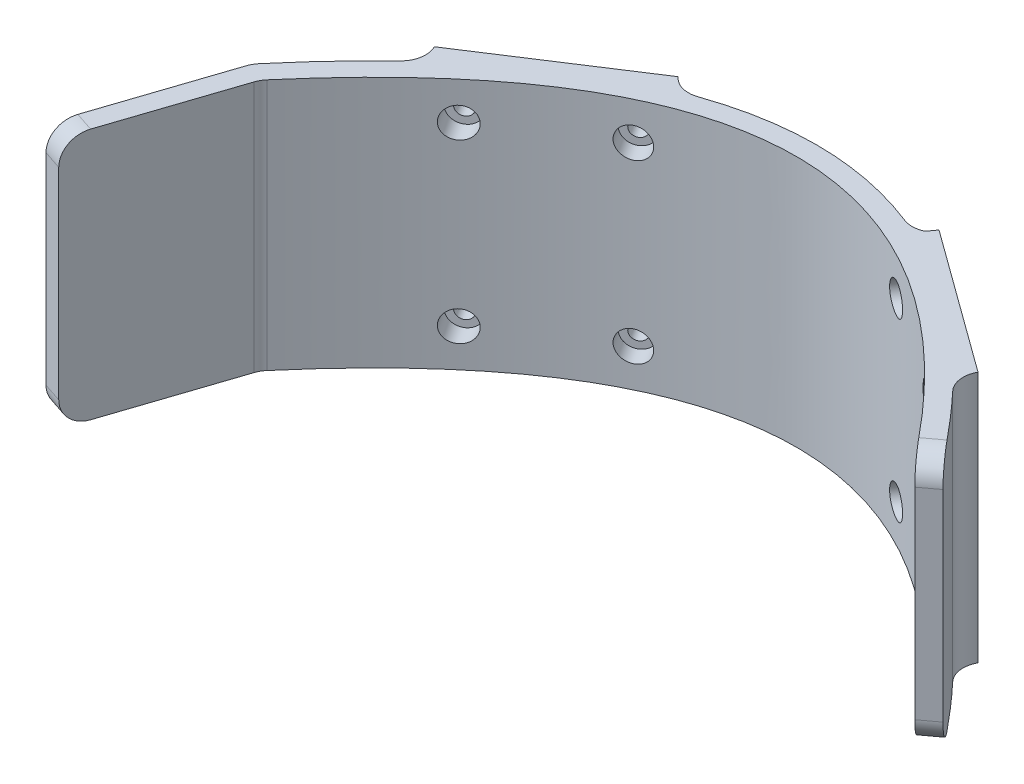
from build123d import *

# Parameters (mm, degrees)
EXTRUDE_518_DEPTH   = 50
EXTRUDE_3_DEPTH     = 50
SKETCH_7_W          = 35
SKETCH_7_H          = 50
EXTRUDE_4_DEPTH     = 2
SKETCH_9_W          = 35
SKETCH_9_H          = 50
EXTRUDE_7_DEPTH     = 2
CUT_EXTRUDE_1_REACH = 186.588
SKETCH_5_R          = 1.65
CUT_EXTRUDE_2_REACH = 190.231
SKETCH_6_R          = 1.6
CUT_EXTRUDE_3_REACH = 189.588
CUT_EXTRUDE_START   = -3
SKETCH_10_R         = 3
CUT_EXTRUDE_4_REACH = 193.231
SKETCH_11_R         = 3
FILLET_START        = 69.07929813
FILLET_1_DEPTH      = 15.92070187
CUT_EXTRUDE_5_DEPTH = 140.842769019
FILLET_5_DEPTH      = 50
FILLET_START_2      = -82.248874185
FILLET_5_2_DEPTH    = 136.130704959
FILLET_START_3      = -71
FILLET_5_3_DEPTH    = 127.377557029
FILLET_5_4_DEPTH    = 50


with BuildPart() as part:
    # 草图1 → Extrude 518 (new body)
    with BuildSketch(Plane(origin=(0, 0, 0), x_dir=(1, 0, 0), z_dir=(0, 1, 0))):
        with BuildLine():
            Line((-83.794733192, -28.735088936), (-80, -30))
            Line((-80, -30), (-70, 0))
            add(Edge.make_bspline(
                [(-70, 0), (-2.236067977, 80.249223595), (60, 0)],
                knots=[0, 0, 0, 1, 1, 1], degree=2))
            add(Edge.make_bspline(
                [(60, 0), (72.314757303, -17.257937134), (80, -98.057134848), (80, -100)],
                knots=[0, 0, 0, 0, 1, 1, 1, 1], degree=3))
            Line((80, -100), (84, -100))
            add(Edge.make_bspline(
                [(84, -100), (84, -99.959886958), (83.998702187, -99.871585847), (83.994846201, -99.759654237), (83.986240115, -99.582476755), (83.962303503, -99.218374034), (83.90343119, -98.472822794), (83.789938955, -97.185208658), (83.581341809, -94.964093759), (83.213758816, -91.29768522), (82.605428893, -85.674062283), (81.834044785, -79.033271633), (80.59373324, -69.099294797), (78.656649569, -55.17705216), (76.230522446, -40.630293547), (74.008089015, -29.437176625), (72.201399356, -21.464643086), (70.252439441, -14.108934539), (68.502001513, -8.646071143), (67.00891604, -4.753669274), (65.833049197, -2.088339118), (64.790849947, -0.085322931), (64.016619658, 1.196481072), (63.6114109, 1.812503646), (63.409013675, 2.106949825), (63.284920778, 2.283139903), (63.235887133, 2.351645721), (63.2097134, 2.388325667)],
                knots=[-0.001253817, -0.001253817, -0.001253817, -0.001253817, 0.002657331, 0.006568479, 0.014390774, 0.030035365, 0.061324547, 0.092613729, 0.123902911, 0.186481274, 0.249059638, 0.311638001, 0.374216365, 0.499373092, 0.624529819, 0.687108182, 0.749686546, 0.812264909, 0.874843273, 0.906132455, 0.937421636, 0.968710818, 0.984355409, 0.992177705, 0.996088852, 0.998044426, 1, 1, 1, 1], degree=3))
            add(Edge.make_bspline(
                [(63.2097134, 2.388325667), (51.280212928, 17.811719498), (30.651240773, 34.166498062), (13.639046127, 42.149170793), (-3.828626529, 44.805457924), (-21.438149711, 42.011295445), (-38.916699142, 33.929127749), (-54.089923665, 22.410216664), (-63.824057794, 12.896858749), (-68.69180734, 7.613741584), (-71.125356785, 4.842073359), (-72.750666275, 2.946716639), (-73.551797384, 1.993718489)],
                knots=[-0.003657098, -0.003657098, -0.003657098, 0.184602227, 0.310108443, 0.435614659, 0.561120876, 0.686627092, 0.812133309, 0.906262971, 0.953327802, 0.976860218, 0.988626425, 1.000392633, 1.000392633, 1.000392633], degree=2))
            Line((-73.551797384, 1.993718489), (-83.794733192, -28.735088936))
        make_face()
    extrude(amount=EXTRUDE_518_DEPTH)

    # 草图4 → 凸台-拉伸3 (add)
    with BuildSketch(Plane(origin=(0, 50, 0), x_dir=(1, 0, 0), z_dir=(0, 1, 0))):
        with BuildLine():
            add(Edge.make_bspline(
                [(-27.24320272, 39.251737644), (-28.711235197, 38.648184747), (-35.700638547, 35.416250073), (-41.196348124, 31.847294586)],
                knots=[0.665570898, 0.665570898, 0.665570898, 0.686627092, 0.765946913, 0.765946913, 0.765946913], degree=2))
            Line((-27.24320272, 39.251737644), (-28, 40.41710326))
            Line((-28, 40.41710326), (-41.196348124, 31.847294586))
        make_face()
        with BuildLine():
            add(Edge.make_bspline(
                [(-41.196348124, 31.847294586), (-44.396393357, 29.769160937), (-52.020982982, 23.980874484), (-56.448628782, 19.961403933)],
                knots=[0.765946913, 0.765946913, 0.765946913, 0.812133309, 0.876314584, 0.876314584, 0.876314584], degree=2))
            Line((-41.196348124, 31.847294586), (-57.353469878, 21.354737034))
            Line((-57.353469878, 21.354737034), (-56.448628782, 19.961403933))
        make_face()
        with BuildLine():
            Line((35.593931445, 30.137934955), (22, 40.014504272))
            Line((22, 40.014504272), (21.328658958, 38.534582951))
            add(Edge.make_bspline(
                [(35.593931445, 30.137934955), (28.951003671, 34.964304379), (21.737163158, 38.349271995), (21.328658958, 38.534582951)],
                knots=[0.209688975, 0.209688975, 0.209688975, 0.310108443, 0.316128132, 0.316128132, 0.316128132], degree=2))
        make_face()
        with BuildLine():
            Line((50.315594803, 19.442020442), (35.593931445, 30.137934955))
            add(Edge.make_bspline(
                [(49.413058713, 18.199786086), (44.198944904, 23.42579322), (37.253464832, 28.932213401), (35.593931445, 30.137934955)],
                knots=[0.104048602, 0.104048602, 0.104048602, 0.184602227, 0.209688975, 0.209688975, 0.209688975], degree=2))
            Line((49.413058713, 18.199786086), (50.315594803, 19.442020442))
        make_face()
    extrude(amount=-EXTRUDE_3_DEPTH)

    # 草图7 → 凸台-拉伸4 (add)
    with BuildSketch(Plane(origin=(26.628840579, 0, -36.651454736), x_dir=(-0.8090169943749487, 0, -0.5877852522924714), z_dir=(0.5877852522924714, 0, -0.8090169943749487))):
        with Locations((-11.778438387, 25)):
            Rectangle(SKETCH_7_W, SKETCH_7_H)
    extrude(amount=EXTRUDE_4_DEPTH)

    # 草图9 → 凸台-拉伸7 (add)
    with BuildSketch(Plane(origin=(-26.767117544, 0, -41.217746488), x_dir=(-0.8386705679454254, 0, 0.5446390350150252), z_dir=(-0.5446390350150251, 0, -0.8386705679454253))):
        with Locations((18.970043785, 25)):
            Rectangle(SKETCH_9_W, SKETCH_9_H)
    extrude(amount=EXTRUDE_7_DEPTH)

    # 草图5 → 切除-拉伸1 (cut, up to next)
    with BuildSketch(Plane(origin=(27.804411084, 0, -38.269488725), x_dir=(-0.8090169943749487, 0, -0.5877852522924714), z_dir=(0.5877852522924714, 0, -0.8090169943749487)), mode=Mode.PRIVATE) as cut_extrude_1_sk1:
        with Locations((-24.278438387, 42.5)):
            Circle(SKETCH_5_R)
    cut_extrude_1_tool1 = extrude(cut_extrude_1_sk1.sketch, amount=-CUT_EXTRUDE_1_REACH, mode=Mode.PRIVATE) & part.part
    # 草图5 → 切除-拉伸1 (cut, up to next)
    with BuildSketch(Plane(origin=(27.804411084, 0, -38.269488725), x_dir=(-0.8090169943749487, 0, -0.5877852522924714), z_dir=(0.5877852522924714, 0, -0.8090169943749487)), mode=Mode.PRIVATE) as cut_extrude_1_sk2:
        with Locations((0.721561613, 42.5)):
            Circle(SKETCH_5_R)
    cut_extrude_1_tool2 = extrude(cut_extrude_1_sk2.sketch, amount=-CUT_EXTRUDE_1_REACH, mode=Mode.PRIVATE) & part.part
    # 草图5 → 切除-拉伸1 (cut, up to next)
    with BuildSketch(Plane(origin=(27.804411084, 0, -38.269488725), x_dir=(-0.8090169943749487, 0, -0.5877852522924714), z_dir=(0.5877852522924714, 0, -0.8090169943749487)), mode=Mode.PRIVATE) as cut_extrude_1_sk3:
        with Locations((0.721561613, 7.5)):
            Circle(SKETCH_5_R)
    cut_extrude_1_tool3 = extrude(cut_extrude_1_sk3.sketch, amount=-CUT_EXTRUDE_1_REACH, mode=Mode.PRIVATE) & part.part
    # 草图5 → 切除-拉伸1 (cut, up to next)
    with BuildSketch(Plane(origin=(27.804411084, 0, -38.269488725), x_dir=(-0.8090169943749487, 0, -0.5877852522924714), z_dir=(0.5877852522924714, 0, -0.8090169943749487)), mode=Mode.PRIVATE) as cut_extrude_1_sk4:
        with Locations((-24.278438387, 7.5)):
            Circle(SKETCH_5_R)
    cut_extrude_1_tool4 = extrude(cut_extrude_1_sk4.sketch, amount=-CUT_EXTRUDE_1_REACH, mode=Mode.PRIVATE) & part.part
    add(cut_extrude_1_tool1.solids().sort_by_distance((47.44608, 42.5, -23.998981))[0], mode=Mode.SUBTRACT)
    add(cut_extrude_1_tool2.solids().sort_by_distance((27.220655, 42.5, -38.693612))[0], mode=Mode.SUBTRACT)
    add(cut_extrude_1_tool3.solids().sort_by_distance((27.220655, 7.5, -38.693612))[0], mode=Mode.SUBTRACT)
    add(cut_extrude_1_tool4.solids().sort_by_distance((47.44608, 7.5, -23.998981))[0], mode=Mode.SUBTRACT)

    # 草图6 → 切除-拉伸2 (cut, up to next)
    with BuildSketch(Plane(origin=(-27.856395614, 0, -42.895087624), x_dir=(-0.8386705679454254, 0, 0.5446390350150252), z_dir=(-0.5446390350150251, 0, -0.8386705679454253)), mode=Mode.PRIVATE) as cut_extrude_2_sk1:
        with Locations((6.47004378, 42.5)):
            Circle(SKETCH_6_R)
    cut_extrude_2_tool1 = extrude(cut_extrude_2_sk1.sketch, amount=-CUT_EXTRUDE_2_REACH, mode=Mode.PRIVATE) & part.part
    # 草图6 → 切除-拉伸2 (cut, up to next)
    with BuildSketch(Plane(origin=(-27.856395614, 0, -42.895087624), x_dir=(-0.8386705679454254, 0, 0.5446390350150252), z_dir=(-0.5446390350150251, 0, -0.8386705679454253)), mode=Mode.PRIVATE) as cut_extrude_2_sk2:
        with Locations((31.47004378, 42.5)):
            Circle(SKETCH_6_R)
    cut_extrude_2_tool2 = extrude(cut_extrude_2_sk2.sketch, amount=-CUT_EXTRUDE_2_REACH, mode=Mode.PRIVATE) & part.part
    # 草图6 → 切除-拉伸2 (cut, up to next)
    with BuildSketch(Plane(origin=(-27.856395614, 0, -42.895087624), x_dir=(-0.8386705679454254, 0, 0.5446390350150252), z_dir=(-0.5446390350150251, 0, -0.8386705679454253)), mode=Mode.PRIVATE) as cut_extrude_2_sk3:
        with Locations((31.47004378, 7.5)):
            Circle(SKETCH_6_R)
    cut_extrude_2_tool3 = extrude(cut_extrude_2_sk3.sketch, amount=-CUT_EXTRUDE_2_REACH, mode=Mode.PRIVATE) & part.part
    # 草图6 → 切除-拉伸2 (cut, up to next)
    with BuildSketch(Plane(origin=(-27.856395614, 0, -42.895087624), x_dir=(-0.8386705679454254, 0, 0.5446390350150252), z_dir=(-0.5446390350150251, 0, -0.8386705679454253)), mode=Mode.PRIVATE) as cut_extrude_2_sk4:
        with Locations((6.47004378, 7.5)):
            Circle(SKETCH_6_R)
    cut_extrude_2_tool4 = extrude(cut_extrude_2_sk4.sketch, amount=-CUT_EXTRUDE_2_REACH, mode=Mode.PRIVATE) & part.part
    add(cut_extrude_2_tool1.solids().sort_by_distance((-33.282631, 42.5, -39.371249))[0], mode=Mode.SUBTRACT)
    add(cut_extrude_2_tool2.solids().sort_by_distance((-54.249395, 42.5, -25.755273))[0], mode=Mode.SUBTRACT)
    add(cut_extrude_2_tool3.solids().sort_by_distance((-54.249395, 7.5, -25.755273))[0], mode=Mode.SUBTRACT)
    add(cut_extrude_2_tool4.solids().sort_by_distance((-33.282631, 7.5, -39.371249))[0], mode=Mode.SUBTRACT)

    # 草图10 → 切除-拉伸3 (cut, up to next)
    with BuildSketch(Plane(origin=(27.804411084, 0, -38.269488725), x_dir=(-0.8090169943749487, 0, -0.5877852522924714), z_dir=(0.5877852522924714, 0, -0.8090169943749487)).offset(CUT_EXTRUDE_START), mode=Mode.PRIVATE) as cut_extrude_3_sk1:
        with Locations((-24.278438387, 42.5)):
            Circle(SKETCH_10_R)
    cut_extrude_3_tool1 = extrude(cut_extrude_3_sk1.sketch, amount=-CUT_EXTRUDE_3_REACH, mode=Mode.PRIVATE) & part.part
    # 草图10 → 切除-拉伸3 (cut, up to next)
    with BuildSketch(Plane(origin=(27.804411084, 0, -38.269488725), x_dir=(-0.8090169943749487, 0, -0.5877852522924714), z_dir=(0.5877852522924714, 0, -0.8090169943749487)).offset(CUT_EXTRUDE_START), mode=Mode.PRIVATE) as cut_extrude_3_sk2:
        with Locations((0.721561613, 42.5)):
            Circle(SKETCH_10_R)
    cut_extrude_3_tool2 = extrude(cut_extrude_3_sk2.sketch, amount=-CUT_EXTRUDE_3_REACH, mode=Mode.PRIVATE) & part.part
    # 草图10 → 切除-拉伸3 (cut, up to next)
    with BuildSketch(Plane(origin=(27.804411084, 0, -38.269488725), x_dir=(-0.8090169943749487, 0, -0.5877852522924714), z_dir=(0.5877852522924714, 0, -0.8090169943749487)).offset(CUT_EXTRUDE_START), mode=Mode.PRIVATE) as cut_extrude_3_sk3:
        with Locations((0.721561613, 7.5)):
            Circle(SKETCH_10_R)
    cut_extrude_3_tool3 = extrude(cut_extrude_3_sk3.sketch, amount=-CUT_EXTRUDE_3_REACH, mode=Mode.PRIVATE) & part.part
    # 草图10 → 切除-拉伸3 (cut, up to next)
    with BuildSketch(Plane(origin=(27.804411084, 0, -38.269488725), x_dir=(-0.8090169943749487, 0, -0.5877852522924714), z_dir=(0.5877852522924714, 0, -0.8090169943749487)).offset(CUT_EXTRUDE_START), mode=Mode.PRIVATE) as cut_extrude_3_sk4:
        with Locations((-24.278438387, 7.5)):
            Circle(SKETCH_10_R)
    cut_extrude_3_tool4 = extrude(cut_extrude_3_sk4.sketch, amount=-CUT_EXTRUDE_3_REACH, mode=Mode.PRIVATE) & part.part
    add(cut_extrude_3_tool1.solids().sort_by_distance((45.682725, 42.5, -21.57193))[0], mode=Mode.SUBTRACT)
    add(cut_extrude_3_tool2.solids().sort_by_distance((25.4573, 42.5, -36.266561))[0], mode=Mode.SUBTRACT)
    add(cut_extrude_3_tool3.solids().sort_by_distance((25.4573, 7.5, -36.266561))[0], mode=Mode.SUBTRACT)
    add(cut_extrude_3_tool4.solids().sort_by_distance((45.682725, 7.5, -21.57193))[0], mode=Mode.SUBTRACT)

    # 草图11 → 切除-拉伸4 (cut, up to next)
    with BuildSketch(Plane(origin=(-27.856395614, 0, -42.895087624), x_dir=(-0.8386705679454254, 0, 0.5446390350150252), z_dir=(-0.5446390350150251, 0, -0.8386705679454253)).offset(CUT_EXTRUDE_START), mode=Mode.PRIVATE) as cut_extrude_4_sk1:
        with Locations((6.47004378, 42.5)):
            Circle(SKETCH_11_R)
    cut_extrude_4_tool1 = extrude(cut_extrude_4_sk1.sketch, amount=-CUT_EXTRUDE_4_REACH, mode=Mode.PRIVATE) & part.part
    # 草图11 → 切除-拉伸4 (cut, up to next)
    with BuildSketch(Plane(origin=(-27.856395614, 0, -42.895087624), x_dir=(-0.8386705679454254, 0, 0.5446390350150252), z_dir=(-0.5446390350150251, 0, -0.8386705679454253)).offset(CUT_EXTRUDE_START), mode=Mode.PRIVATE) as cut_extrude_4_sk2:
        with Locations((31.47004379, 42.5)):
            Circle(SKETCH_11_R)
    cut_extrude_4_tool2 = extrude(cut_extrude_4_sk2.sketch, amount=-CUT_EXTRUDE_4_REACH, mode=Mode.PRIVATE) & part.part
    # 草图11 → 切除-拉伸4 (cut, up to next)
    with BuildSketch(Plane(origin=(-27.856395614, 0, -42.895087624), x_dir=(-0.8386705679454254, 0, 0.5446390350150252), z_dir=(-0.5446390350150251, 0, -0.8386705679454253)).offset(CUT_EXTRUDE_START), mode=Mode.PRIVATE) as cut_extrude_4_sk3:
        with Locations((31.47004379, 7.5)):
            Circle(SKETCH_11_R)
    cut_extrude_4_tool3 = extrude(cut_extrude_4_sk3.sketch, amount=-CUT_EXTRUDE_4_REACH, mode=Mode.PRIVATE) & part.part
    # 草图11 → 切除-拉伸4 (cut, up to next)
    with BuildSketch(Plane(origin=(-27.856395614, 0, -42.895087624), x_dir=(-0.8386705679454254, 0, 0.5446390350150252), z_dir=(-0.5446390350150251, 0, -0.8386705679454253)).offset(CUT_EXTRUDE_START), mode=Mode.PRIVATE) as cut_extrude_4_sk4:
        with Locations((6.47004378, 7.5)):
            Circle(SKETCH_11_R)
    cut_extrude_4_tool4 = extrude(cut_extrude_4_sk4.sketch, amount=-CUT_EXTRUDE_4_REACH, mode=Mode.PRIVATE) & part.part
    add(cut_extrude_4_tool1.solids().sort_by_distance((-31.648714, 42.5, -36.855238))[0], mode=Mode.SUBTRACT)
    add(cut_extrude_4_tool2.solids().sort_by_distance((-52.615478, 42.5, -23.239262))[0], mode=Mode.SUBTRACT)
    add(cut_extrude_4_tool3.solids().sort_by_distance((-52.615478, 7.5, -23.239262))[0], mode=Mode.SUBTRACT)
    add(cut_extrude_4_tool4.solids().sort_by_distance((-31.648714, 7.5, -36.855238))[0], mode=Mode.SUBTRACT)

    # 圆角1: read off the stored shape, not the designer's step
    # 圆角1 outline → 圆角1 (cut)
    with BuildSketch(Plane.YZ.offset(FILLET_START)):
        with BuildLine():
            Line((50, 99.999999995), (0, 99.999999995))
            ThreePointArc((0, 99.999999995), (36.332495807, 70.559374674), (50, 25.838015124))
            Line((50, 25.838015124), (50, 99.999999995))
        make_face()
    extrude(amount=FILLET_1_DEPTH, mode=Mode.SUBTRACT)

    # 草图12 → 切除-拉伸5 (cut, through all)
    with BuildSketch(Plane(origin=(0, 50, 0), x_dir=(1, 0, 0), z_dir=(0, 1, 0))):
        with BuildLine():
            Line((63.2097134, 2.388325667), (60, 0))
            add(Edge.make_bspline(
                [(60, 0), (63.40098387, -4.766148806), (66.448871666, -14.378630659), (69.079298228, -25.838015128)],
                knots=[0, 0, 0, 0, 0.276171408, 0.276171408, 0.276171408, 0.276171408], degree=3))
            add(Edge.make_bspline(
                [(69.079298228, -25.838015128), (75.973487472, -55.872370115), (80, -98.593698653), (80, -100)],
                knots=[0, 0, 0, 0, 0.723828592, 0.723828592, 0.723828592, 0.723828592], degree=3))
            Line((80, -100), (84, -100))
            add(Edge.make_bspline(
                [(84, -100), (84, -99.959886958), (83.998702187, -99.871585847), (83.994846201, -99.759654237), (83.986240115, -99.582476755), (83.962303503, -99.218374034), (83.90343119, -98.472822794), (83.789938955, -97.185208658), (83.581341809, -94.964093759), (83.213758816, -91.29768522), (82.605428893, -85.674062283), (81.834044785, -79.033271633), (80.59373324, -69.099294797), (78.656649569, -55.17705216), (76.230522446, -40.630293547), (74.311401844, -30.964788617), (73.454210279, -27.044660317), (73.181678851, -25.838015129)],
                knots=[0.283221868, 0.283221868, 0.283221868, 0.283221868, 0.287133015, 0.291044163, 0.298866458, 0.314511049, 0.345800231, 0.377089413, 0.408378595, 0.470956958, 0.533535322, 0.596113685, 0.658692049, 0.783848776, 0.909005503, 0.971583866, 1, 1, 1, 1], degree=3))
            add(Edge.make_bspline(
                [(73.181678851, -25.838015129), (72.85403817, -24.387371234), (71.906399071, -20.351261482), (70.252439441, -14.108934539), (68.502001513, -8.646071143), (67.00891604, -4.753669274), (65.833049197, -2.088339118), (64.790849947, -0.085322931), (64.016619658, 1.196481072), (63.6114109, 1.812503646), (63.409013675, 2.106949825), (63.284920778, 2.283139903), (63.235887133, 2.351645721), (63.2097134, 2.388325667)],
                knots=[0.715524316, 0.715524316, 0.715524316, 0.715524316, 0.749686546, 0.812264909, 0.874843273, 0.906132455, 0.937421636, 0.968710818, 0.984355409, 0.992177705, 0.996088852, 0.998044426, 1, 1, 1, 1], degree=3))
        make_face()
    extrude(amount=-CUT_EXTRUDE_5_DEPTH, mode=Mode.SUBTRACT)

    # 圆角5: read off the stored shape, not the designer's step
    # 圆角5 outline → 圆角5 (add)
    with BuildSketch(Plane(origin=(0, 0, 0), x_dir=(1, 0, 0), z_dir=(0, 1, 0))):
        with BuildLine():
            Line((-70, 0), (-70.305472775, -0.916418325))
            ThreePointArc((-70.305472775, -0.916418325), (-69.916678974, -0.040473266), (-69.367906722, 0.745204391))
            add(Edge.make_bspline(
                [(-70, 0), (-69.683893216, 0.374348465), (-69.367906722, 0.745204391)],
                knots=[0, 0, 0, 0.004664824, 0.004664824, 0.004664824], degree=2))
        make_face()
        with BuildLine():
            ThreePointArc((-58.442747948, 23.03207817), (-57.976074141, 19.933358446), (-59.445305232, 17.165469652))
            add(Edge.make_bspline(
                [(-56.44862878, 19.961403935), (-57.947323557, 18.600870641), (-59.445305232, 17.165469652)],
                knots=[0.876314584, 0.876314584, 0.876314584, 0.898039027, 0.898039027, 0.898039027], degree=2))
            Line((-56.44862878, 19.961403935), (-58.442747948, 23.03207817))
        make_face()
        with BuildLine():
            add(Edge.make_bspline(
                [(52.258321344, 15.265089958), (50.838755412, 16.770837391), (49.413058713, 18.199786086)],
                knots=[0.082022801, 0.082022801, 0.082022801, 0.104048602, 0.104048602, 0.104048602], degree=2))
            ThreePointArc((52.258321344, 15.265089958), (50.939681442, 18.038785695), (51.491165308, 21.060054431))
            Line((51.491165308, 21.060054431), (49.413058713, 18.199786086))
        make_face()
        with BuildLine():
            Line((21.328658958, 38.534582951), (22, 40.014504272))
            ThreePointArc((22, 40.014504272), (20.055781864, 39.561143282), (18.089166162, 39.904571627))
            add(Edge.make_bspline(
                [(21.328658958, 38.534582951), (19.713010126, 39.267494461), (18.089166162, 39.904571627)],
                knots=[0.316128132, 0.316128132, 0.316128132, 0.33993622, 0.33993622, 0.33993622], degree=2))
        make_face()
        with BuildLine():
            add(Edge.make_bspline(
                [(-23.641505302, 40.619550054), (-25.443738749, 39.991552131), (-27.243202714, 39.251737647)],
                knots=[0.639760936, 0.639760936, 0.639760936, 0.665570898, 0.665570898, 0.665570898], degree=2))
            ThreePointArc((-23.641505302, 40.619550054), (-26.593386975, 40.5148579), (-29.08927807, 42.094444396))
            Line((-29.08927807, 42.094444396), (-27.243202714, 39.251737647))
        make_face()
    extrude(amount=FILLET_5_DEPTH)

    # Fillet 5 2 outline → Fillet 5 2 (cut)
    with BuildSketch(Plane(origin=(0, 0, 0), x_dir=(0.5969627896068318, 0, 0.8022689248779548), z_dir=(0.8022689248779548, 0, -0.5969627896068319)).offset(FILLET_START_2)):
        with BuildLine():
            Line((35.817767376, -50), (35.817767376, -45))
            ThreePointArc((35.817767376, -45), (34.353301282, -48.535533906), (30.817767376, -50))
            Line((30.817767376, -50), (35.817767376, -50))
        make_face()
        with BuildLine():
            ThreePointArc((30.817767376, 0), (34.353301282, -1.464466094), (35.817767376, -5))
            Line((35.817767376, -5), (35.817767376, 0))
            Line((35.817767376, 0), (30.817767376, 0))
        make_face()
    extrude(amount=FILLET_5_2_DEPTH, mode=Mode.SUBTRACT)

    # Fillet 5 3 outline → Fillet 5 3 (cut)
    with BuildSketch(Plane(origin=(0, 0, 0), x_dir=(0, 1, 0), z_dir=(0.9486832980505139, 0, 0.316227766016838)).offset(FILLET_START_3)):
        with BuildLine():
            Line((0, 53.758720223), (0, 48.758720223))
            ThreePointArc((0, 48.758720223), (1.464466094, 52.294254129), (5, 53.758720223))
            Line((5, 53.758720223), (0, 53.758720223))
        make_face()
        with BuildLine():
            Line((50, 53.758720223), (45, 53.758720223))
            ThreePointArc((45, 53.758720223), (48.535533906, 52.294254129), (50, 48.758720223))
            Line((50, 48.758720223), (50, 53.758720223))
        make_face()
    extrude(amount=FILLET_5_3_DEPTH, mode=Mode.SUBTRACT)

    # Fillet 5 4 outline → Fillet 5 4 (cut)
    with BuildSketch(Plane(origin=(0, 0, 0), x_dir=(1, 0, 0), z_dir=(0, 1, 0))):
        with BuildLine():
            Line((-73.551797384, 1.993718489), (-73.855216409, 1.083461413))
            ThreePointArc((-73.855216409, 1.083461413), (-73.469886153, 1.95325799), (-72.926788732, 2.734328207))
            add(Edge.make_bspline(
                [(-72.926788732, 2.734328207), (-73.2401649, 2.364425827), (-73.551797384, 1.993718489)],
                knots=[0.995815689, 0.995815689, 0.995815689, 1.000392633, 1.000392633, 1.000392633], degree=2))
        make_face()
    extrude(amount=FILLET_5_4_DEPTH, mode=Mode.SUBTRACT)


solid = part.part
